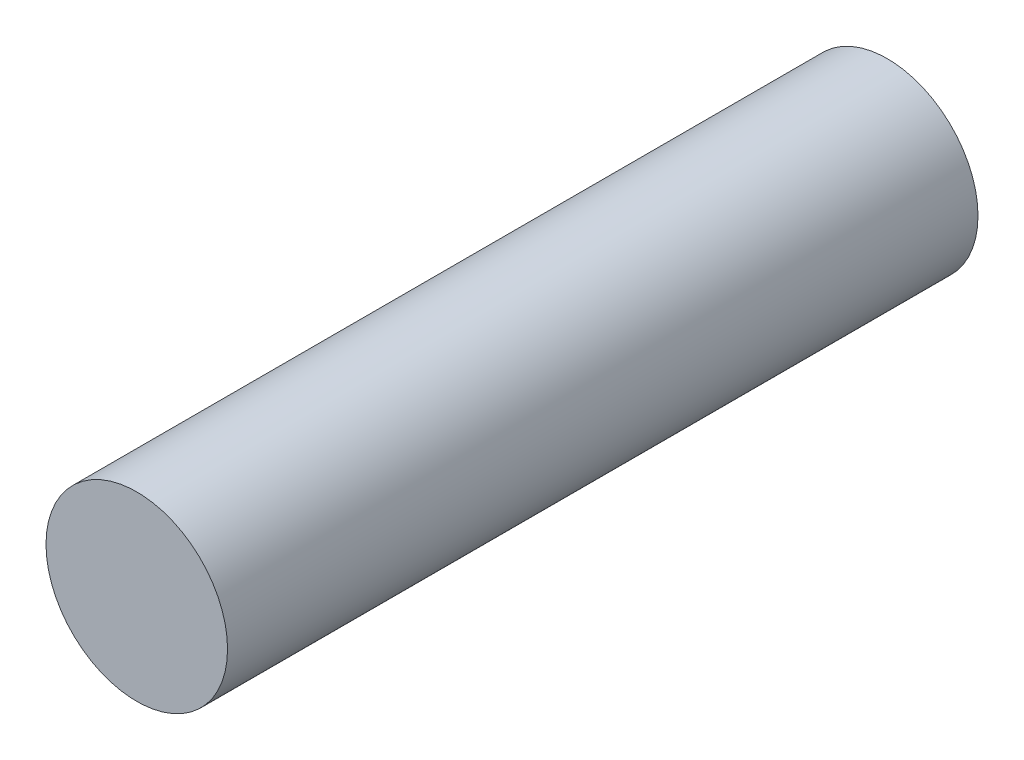
from build123d import *

# Parameters (mm, degrees)
SKETCH2_R           = 12.7
BOSS_EXTRUDE1_DEPTH = 52.5


with BuildPart() as part:
    # Sketch2 → Boss-Extrude1 (new, symmetric)
    with BuildSketch(Plane.XY):
        with Locations((-80, 0)):
            Circle(SKETCH2_R)
    extrude(amount=BOSS_EXTRUDE1_DEPTH, both=True)


solid = part.part
